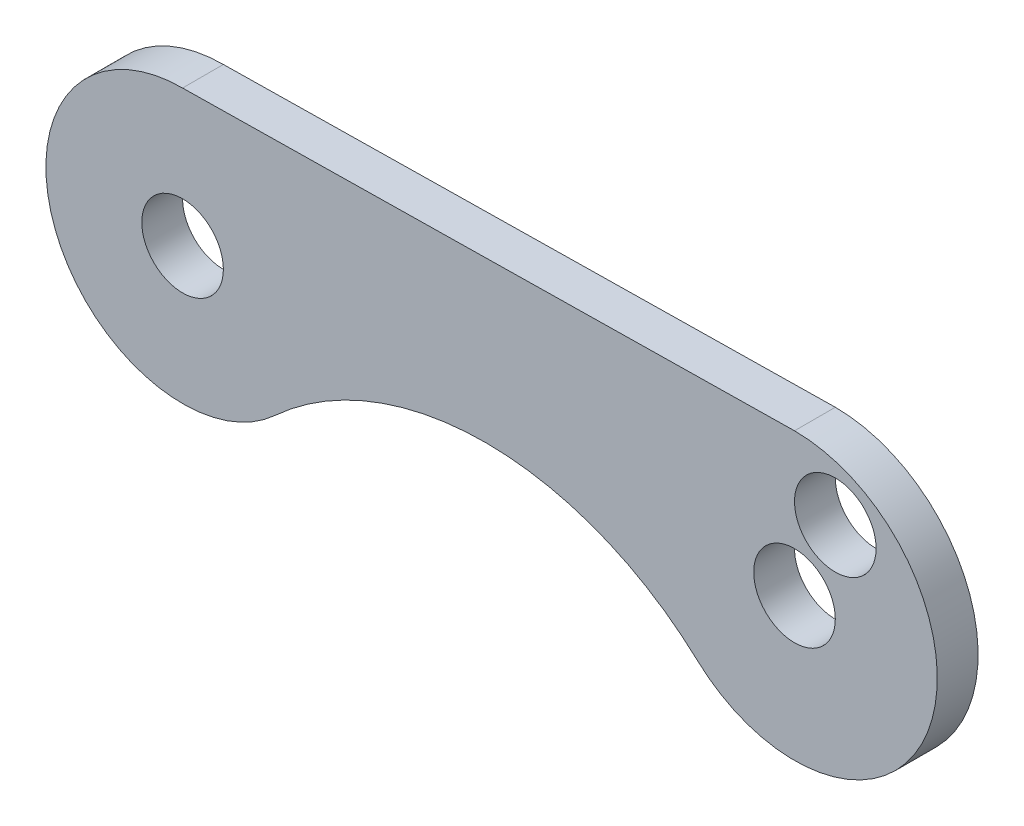
from build123d import *

# Parameters (mm, degrees)
SKETCH1_R           = 2
BOSS_EXTRUDE1_DEPTH = 2


with BuildPart() as part:
    # Sketch1 → Boss-Extrude1 (new body)
    with BuildSketch(Plane.XY):
        with BuildLine():
            Line((-1.2291645, 7.272594351), (-31.0207003, 6.828891045))
            ThreePointArc((-31.0207003, 6.828891045), (-37.265506934, -2.298533536), (-26.495686232, -4.812186538))
            ThreePointArc((-26.495686232, -4.812186538), (-16.124738491, -0.795589275), (-5.773714379, -4.863255736))
            ThreePointArc((-5.773714379, -4.863255736), (5.497454504, -2.276487762), (-1.0207003, 7.275699134))
            Line((-1.0207003, 7.275699134), (-1.2291645, 7.272594351))
        make_face()
        with Locations((-31.0207003, 0.128891045)):
            Circle(SKETCH1_R, mode=Mode.SUBTRACT)
        with Locations((-1.0207003, 0.275699134)):
            Circle(SKETCH1_R, mode=Mode.SUBTRACT)
        with Locations((0.9792997, 4.275699134)):
            Circle(SKETCH1_R, mode=Mode.SUBTRACT)
    extrude(amount=BOSS_EXTRUDE1_DEPTH)


solid = part.part
